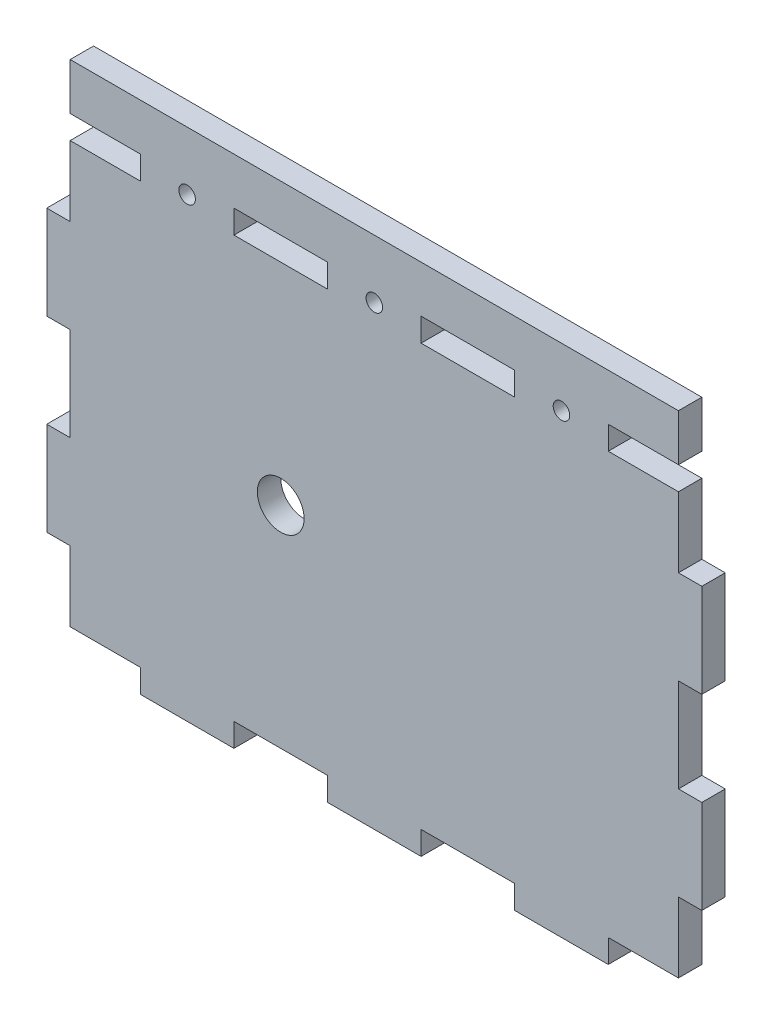
from build123d import *

# Parameters (mm, degrees)
SKETCH1_W                 = 177.8
SKETCH1_H                 = 139.7
BOSS_EXTRUDE1_DEPTH       = 6.35
SKETCH5_W                 = 6.35
SKETCH5_H                 = 25.4
CUT_EXTRUDE4_DEPTH        = 6.35
SKETCH6_W                 = 25.4
SKETCH6_H                 = 6.35
CUT_EXTRUDE5_DEPTH        = 6.35
LPATTERN5_COUNT           = 3
LPATTERN5_PITCH           = 50.8
LPATTERN5_COUNT_DIR2      = 2
LPATTERN5_PITCH_DIR2      = 171.45
LPATTERN6_COUNT           = 4
LPATTERN6_PITCH           = 50.8
LPATTERN6_COUNT_DIR2      = 2
LPATTERN6_PITCH_DIR2      = 120.65
SKETCH7_W                 = 6.35
SKETCH7_H                 = 19.05
SKETCH7_H_2               = 12.7
CUT_EXTRUDE6_DEPTH        = 6.35
F_8_CLEARANCE_HOLE1_D     = 4.4958
F_8_CLEARANCE_HOLE1_DEPTH = 10.16
F_8_CLEARANCE_HOLE1_TIP   = 1.350674586
SKETCH11_R                = 6.35
CUT_EXTRUDE7_DEPTH        = 7.62


with BuildPart() as part:
    # Sketch1 → Boss-Extrude1 (new body)
    with BuildSketch(Plane.XY):
        with Locations((88.9, 69.85)):
            Rectangle(SKETCH1_W, SKETCH1_H)
    extrude(amount=BOSS_EXTRUDE1_DEPTH)

    # Sketch5 → Cut-Extrude4 (cut)
    with BuildSketch(Plane.XY.offset(6.35)):
        with Locations((3.175, 12.7)):
            Rectangle(SKETCH5_W, SKETCH5_H)
    cut_extrude4 = extrude(amount=-CUT_EXTRUDE4_DEPTH, mode=Mode.SUBTRACT)

    # Sketch6 → Cut-Extrude5 (cut)
    with BuildSketch(Plane.XY.offset(6.35)):
        with Locations((12.7, 3.175)):
            Rectangle(SKETCH6_W, SKETCH6_H)
    cut_extrude5 = extrude(amount=-CUT_EXTRUDE5_DEPTH, mode=Mode.SUBTRACT)

    # LPattern5: Cut-Extrude4 3 × 2
    with Locations(*[(j * LPATTERN5_PITCH_DIR2, i * LPATTERN5_PITCH, 0) for i in range(LPATTERN5_COUNT) for j in range(LPATTERN5_COUNT_DIR2) if (i, j) != (0, 0)]):
        add(cut_extrude4, mode=Mode.SUBTRACT)

    # LPattern6: Cut-Extrude5 4 × 2
    with Locations(*[(i * LPATTERN6_PITCH, j * LPATTERN6_PITCH_DIR2, 0) for i in range(LPATTERN6_COUNT) for j in range(LPATTERN6_COUNT_DIR2) if (i, j) != (0, 0)]):
        add(cut_extrude5, mode=Mode.SUBTRACT)

    # Sketch7 → Cut-Extrude6 (cut)
    with BuildSketch(Plane.XY.offset(6.35)):
        with Locations((3.175, 130.175)):
            Rectangle(SKETCH7_W, SKETCH7_H)
        with Locations((174.625, 133.35)):
            Rectangle(SKETCH7_W, SKETCH7_H_2)
    extrude(amount=-CUT_EXTRUDE6_DEPTH, mode=Mode.SUBTRACT)

    # #8 Clearance Hole1
    with Locations(Plane.XY.offset(6.35)):
        with Locations((38.1, 123.825), (88.9, 123.825), (139.7, 123.825)):
            Hole(F_8_CLEARANCE_HOLE1_D / 2, depth=F_8_CLEARANCE_HOLE1_DEPTH)
            with Locations((0, 0, -(F_8_CLEARANCE_HOLE1_DEPTH + F_8_CLEARANCE_HOLE1_TIP / 2))):  # 118° drill point
                Cone(0, F_8_CLEARANCE_HOLE1_D / 2, F_8_CLEARANCE_HOLE1_TIP, mode=Mode.SUBTRACT)

    # Sketch11 → Cut-Extrude7 (cut)
    with BuildSketch(Plane.XY.offset(6.35)):
        with Locations((63.5, 63.5)):
            Circle(SKETCH11_R)
    extrude(amount=-CUT_EXTRUDE7_DEPTH, mode=Mode.SUBTRACT)


solid = part.part
